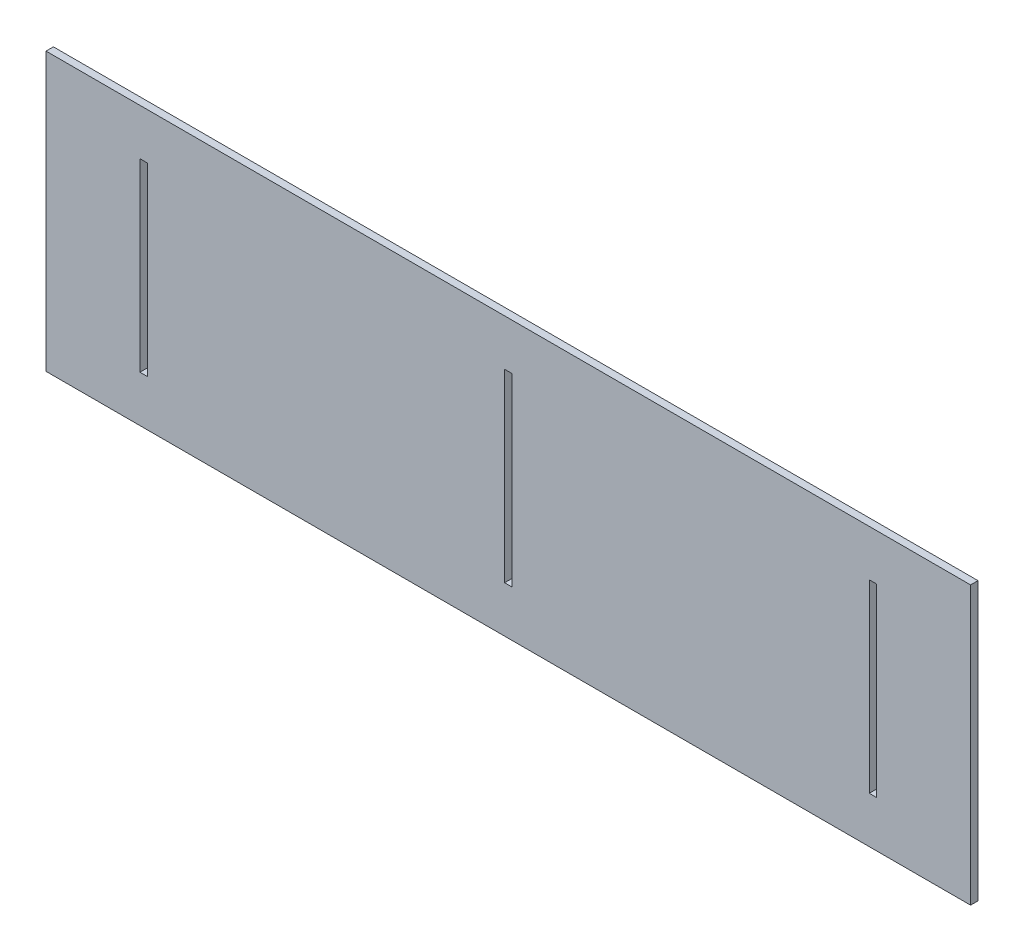
from build123d import *

# Parameters (mm, degrees)
SKETCH_2_W               = 250
SKETCH_2_H               = 75
EXTRUDE_3_DEPTH          = 2
CUT_EXTRUDE_1_DEPTH      = 2
CUT_EXTRUDE_1_DEPTH_BACK = 2
SKETCH_4_W               = 2
SKETCH_4_H               = 50


with BuildPart() as part:
    # 草图2 → 凸台-拉伸3 (new body)
    with BuildSketch(Plane.XY):
        with Locations((51.318241286, 40.884671024)):
            Rectangle(SKETCH_2_W, SKETCH_2_H)
    extrude(amount=EXTRUDE_3_DEPTH)

    # 草图4 → 切除-拉伸1 (cut, two sides: drawn at the far end of the back side and taken through both)
    with BuildSketch(Plane.XY.offset(-CUT_EXTRUDE_1_DEPTH_BACK)):
        with Locations((149.918241286, 40.884671024)):
            Rectangle(SKETCH_4_W, SKETCH_4_H)
        with Locations((-47.281758714, 40.884671024)):
            Rectangle(SKETCH_4_W, SKETCH_4_H)
        with Locations((51.318241286, 40.884671024)):
            Rectangle(SKETCH_4_W, SKETCH_4_H)
    extrude(amount=CUT_EXTRUDE_1_DEPTH + CUT_EXTRUDE_1_DEPTH_BACK, mode=Mode.SUBTRACT)


solid = part.part
